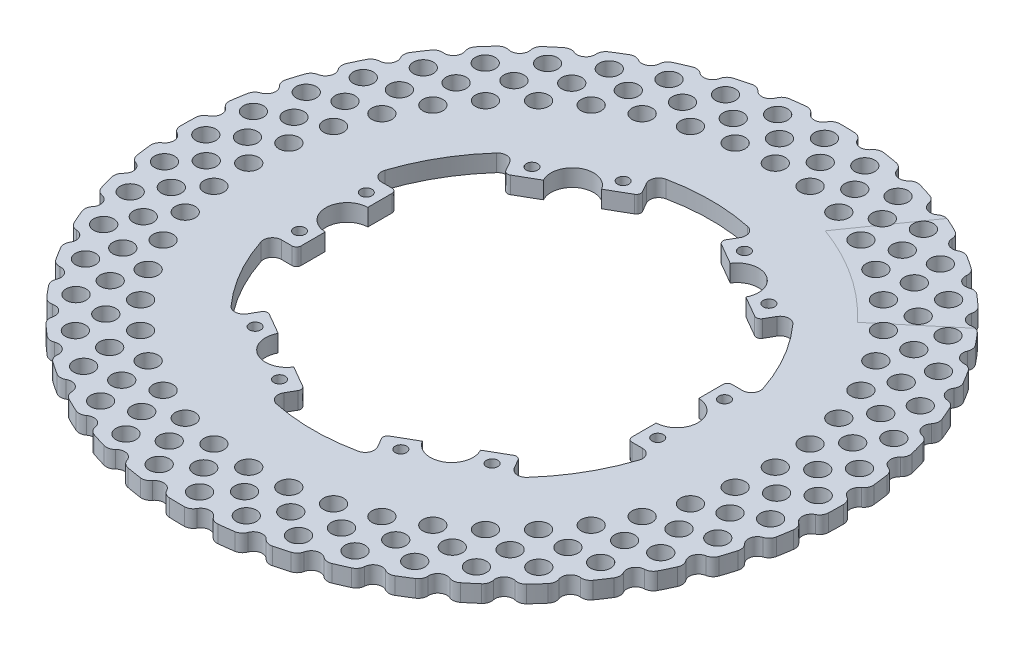
from build123d import *

# Parameters (mm, degrees)
SKETCH1_R             = 92.075
BOSS_EXTRUDE1_DEPTH   = 4.7625
FILLET1_R             = 2.54
FILLET2_R             = 2.54
SKETCH2_R             = 1.5875
CUT_EXTRUDE2_DEPTH    = 131.30077765
SKETCH4_R             = 2.794
CUT_EXTRUDE3_DEPTH    = 131.30077765
CRVPATTERN1_OUTLINE_R = 2.794
CRVPATTERN1_DEPTH     = 4.7625
CIRPATTERN1_COUNT     = 44
CUT_EXTRUDE6_DEPTH    = 131.30077765
CIRPATTERN3_COUNT     = 44


# Read off the part's stored shape, not the designer's step: CrvPattern1
with BuildPart() as part:
    # Sketch1 → Boss-Extrude1 (new body)
    with BuildSketch(Plane(origin=(0, 0, 0), x_dir=(1, 0, 0), z_dir=(0, 1, 0))):
        with Locations(Location((0, 0, 0), (0, 0, 90))):
            Circle(SKETCH1_R)
        with BuildLine():
            Line((-46.2153, 5.950469261), (-46.2153, 12.7))
            ThreePointArc((-46.2153, 12.7), (-46.587274388, 13.598025612), (-47.4853, 13.97))
            Line((-47.4853, 13.97), (-53.777602273, 13.97))
            ThreePointArc((-53.777602273, 13.97), (-48.118536498, 27.78125), (-38.987176027, 39.587769723))
            Line((-38.987176027, 39.587769723), (-35.841024891, 34.138476106))
            ThreePointArc((-35.841024891, 34.138476106), (-35.069872815, 33.546750307), (-34.106172628, 33.673623844))
            Line((-34.106172628, 33.673623844), (-28.260907544, 37.048389213))
            ThreePointArc((-28.260907544, 37.048389213), (-25.9953125, 45.025202009), (-17.954392456, 42.998858474))
            Line((-17.954392456, 42.998858474), (-12.109127372, 46.373623844))
            ThreePointArc((-12.109127372, 46.373623844), (-11.517401573, 47.144775919), (-11.644275109, 48.108476106))
            Line((-11.644275109, 48.108476106), (-14.790426246, 53.557769723))
            ThreePointArc((-14.790426246, 53.557769723), (0, 55.5625), (14.790426246, 53.557769723))
            Line((14.790426246, 53.557769723), (11.644275109, 48.108476106))
            ThreePointArc((11.644275109, 48.108476106), (11.517401573, 47.144775919), (12.109127372, 46.373623844))
            Line((12.109127372, 46.373623844), (17.954392456, 42.998858474))
            ThreePointArc((17.954392456, 42.998858474), (25.9953125, 45.025202009), (28.260907544, 37.048389213))
            Line((28.260907544, 37.048389213), (34.106172628, 33.673623844))
            ThreePointArc((34.106172628, 33.673623844), (35.069872815, 33.546750307), (35.841024891, 34.138476106))
            Line((35.841024891, 34.138476106), (38.987176027, 39.587769723))
            ThreePointArc((38.987176027, 39.587769723), (48.118536498, 27.78125), (53.777602273, 13.97))
            Line((53.777602273, 13.97), (47.4853, 13.97))
            ThreePointArc((47.4853, 13.97), (46.587274388, 13.598025612), (46.2153, 12.7))
            Line((46.2153, 12.7), (46.2153, 5.950469261))
            ThreePointArc((46.2153, 5.950469261), (51.990625, 0), (46.2153, -5.950469261))
            Line((46.2153, -5.950469261), (46.2153, -12.7))
            ThreePointArc((46.2153, -12.7), (46.587274388, -13.598025612), (47.4853, -13.97))
            Line((47.4853, -13.97), (53.777602273, -13.97))
            ThreePointArc((53.777602273, -13.97), (48.118536498, -27.78125), (38.987176027, -39.587769723))
            Line((38.987176027, -39.587769723), (35.841024891, -34.138476106))
            ThreePointArc((35.841024891, -34.138476106), (35.069872815, -33.546750307), (34.106172628, -33.673623844))
            Line((34.106172628, -33.673623844), (28.260907544, -37.048389213))
            ThreePointArc((28.260907544, -37.048389213), (25.9953125, -45.025202009), (17.954392456, -42.998858474))
            Line((17.954392456, -42.998858474), (12.109127372, -46.373623844))
            ThreePointArc((12.109127372, -46.373623844), (11.517401573, -47.144775919), (11.644275109, -48.108476106))
            Line((11.644275109, -48.108476106), (14.790426246, -53.557769723))
            ThreePointArc((14.790426246, -53.557769723), (0, -55.5625), (-14.790426246, -53.557769723))
            Line((-14.790426246, -53.557769723), (-11.644275109, -48.108476106))
            ThreePointArc((-11.644275109, -48.108476106), (-11.517401573, -47.144775919), (-12.109127372, -46.373623844))
            Line((-12.109127372, -46.373623844), (-17.954392456, -42.998858474))
            ThreePointArc((-17.954392456, -42.998858474), (-25.9953125, -45.025202009), (-28.260907544, -37.048389213))
            Line((-28.260907544, -37.048389213), (-34.106172628, -33.673623844))
            ThreePointArc((-34.106172628, -33.673623844), (-35.069872815, -33.546750307), (-35.841024891, -34.138476106))
            Line((-35.841024891, -34.138476106), (-38.987176027, -39.587769723))
            ThreePointArc((-38.987176027, -39.587769723), (-48.118536498, -27.78125), (-53.777602273, -13.97))
            Line((-53.777602273, -13.97), (-47.4853, -13.97))
            ThreePointArc((-47.4853, -13.97), (-46.587274388, -13.598025612), (-46.2153, -12.7))
            Line((-46.2153, -12.7), (-46.2153, -5.950469261))
            ThreePointArc((-46.2153, -5.950469261), (-51.990625, 0), (-46.2153, 5.950469261))
        make_face(mode=Mode.SUBTRACT)
    extrude(amount=BOSS_EXTRUDE1_DEPTH)

    # Fillet1
    fillet1_edges = [part.edges().sort_by_distance(p)[0] for p in [
        (-53.777602273, 2.38125, -13.97),
    ]]
    fillet(fillet1_edges, radius=FILLET1_R)

    # Fillet2
    fillet2_edges = [part.edges().sort_by_distance(p)[0] for p in [
        (-53.777602273, 2.38125, 13.97),
        (-38.987176027, 2.38125, 39.587769723),
        (-14.790426246, 2.38125, 53.557769723),
        (14.790426246, 2.38125, 53.557769723),
        (38.987176027, 2.38125, 39.587769723),
        (53.777602273, 2.38125, 13.97),
        (53.777602273, 2.38125, -13.97),
        (38.987176027, 2.38125, -39.587769723),
        (14.790426246, 2.38125, -53.557769723),
        (-14.790426246, 2.38125, -53.557769723),
        (-38.987176027, 2.38125, -39.587769723),
    ]]
    fillet(fillet2_edges, radius=FILLET2_R)

    # Sketch2 → Cut-Extrude2 (cut, through all)
    with BuildSketch(Plane(origin=(0, 4.7625, 0), x_dir=(1, 0, 0), z_dir=(0, 1, 0))):
        with Locations(Location((-50.0253, 9.32523463, 0), (0, 0, 270))):
            Circle(SKETCH2_R)
        with Locations(Location((-50.0253, -9.32523463, 0), (0, 0, 270))):
            Circle(SKETCH2_R)
        with Locations(Location((-33.088540086, 38.660563317, 0), (0, 0, 270))):
            Circle(SKETCH2_R)
        with Locations(Location((-16.936759914, 47.985797947, 0), (0, 0, 270))):
            Circle(SKETCH2_R)
        with Locations(Location((16.936759914, 47.985797947, 0), (0, 0, 270))):
            Circle(SKETCH2_R)
        with Locations(Location((33.088540086, 38.660563317, 0), (0, 0, 270))):
            Circle(SKETCH2_R)
        with Locations(Location((50.0253, 9.32523463, 0), (0, 0, 270))):
            Circle(SKETCH2_R)
        with Locations(Location((50.0253, -9.32523463, 0), (0, 0, 270))):
            Circle(SKETCH2_R)
        with Locations(Location((33.088540086, -38.660563317, 0), (0, 0, 270))):
            Circle(SKETCH2_R)
        with Locations(Location((16.936759914, -47.985797947, 0), (0, 0, 270))):
            Circle(SKETCH2_R)
        with Locations(Location((-16.936759914, -47.985797947, 0), (0, 0, 270))):
            Circle(SKETCH2_R)
        with Locations(Location((-33.088540086, -38.660563317, 0), (0, 0, 270))):
            Circle(SKETCH2_R)
    extrude(amount=-CUT_EXTRUDE2_DEPTH, mode=Mode.SUBTRACT)

    # Sketch4 → Cut-Extrude3 (cut, through all)
    with BuildSketch(Plane(origin=(0, 4.7625, 0), x_dir=(1, 0, 0), z_dir=(0, 1, 0))):
        with Locations(Location((-73.536682193, 0, 0), (0, 0, 270))):
            Circle(SKETCH4_R)
    cut_extrude3 = extrude(amount=-CUT_EXTRUDE3_DEPTH, mode=Mode.SUBTRACT)

    # CrvPattern1 outline → CrvPattern1 (cut)
    with BuildSketch(Plane(origin=(0, 0, 0), x_dir=(1, 0, 0), z_dir=(0, 1, 0))):
        with Locations((-85.383269547, 13.155765025)):
            Circle(CRVPATTERN1_OUTLINE_R)
        with Locations((-79.990576354, 6.100508244)):
            Circle(CRVPATTERN1_OUTLINE_R)
    crvpattern1 = extrude(amount=CRVPATTERN1_DEPTH, mode=Mode.SUBTRACT)

    # CirPattern1: Cut-Extrude3, CrvPattern1 ×44 about axis
    cirpattern1_axis = Axis((0, 4.7625, 0), (0, -1, 0))
    add([cut_extrude3.rotate(cirpattern1_axis, i * 360 / CIRPATTERN1_COUNT) for i in range(1, CIRPATTERN1_COUNT)], mode=Mode.SUBTRACT)
    add([crvpattern1.rotate(cirpattern1_axis, i * 360 / CIRPATTERN1_COUNT) for i in range(1, CIRPATTERN1_COUNT)], mode=Mode.SUBTRACT)

    # Sketch24 → Cut-Extrude6 (cut, through all)
    with BuildSketch(Plane(origin=(0, 4.7625, 0), x_dir=(1, 0, 0), z_dir=(0, 1, 0))):
        with BuildLine():
            ThreePointArc((-88.837684968, 18.670164821), (-87.156024638, 20.50228266), (-87.844564831, 22.891958296))
            ThreePointArc((-87.844564831, 22.891958296), (-88.517621187, 24.056102171), (-88.502028969, 25.400718363))
            ThreePointArc((-88.502028969, 25.400718363), (-89.628535975, 21.0839077), (-90.544616485, 16.717597033))
            ThreePointArc((-90.544616485, 16.717597033), (-89.959138296, 17.928155215), (-88.837684968, 18.670164821))
        make_face()
    cut_extrude6 = extrude(amount=-CUT_EXTRUDE6_DEPTH, mode=Mode.SUBTRACT)

    # CirPattern3: Cut-Extrude6 ×44 about axis
    cirpattern3_axis = Axis((0, 0, 0), (0, 1, 0))
    for i in range(1, CIRPATTERN3_COUNT):
        add(cut_extrude6.rotate(cirpattern3_axis, i * 360 / CIRPATTERN3_COUNT), mode=Mode.SUBTRACT)


solid = part.part
